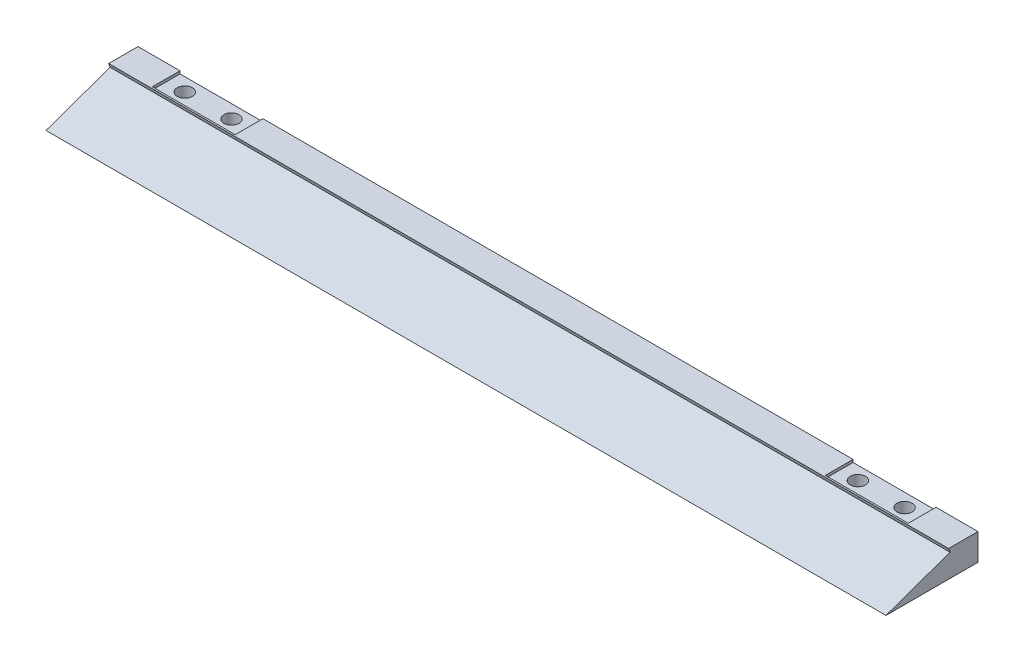
from build123d import *

# Parameters (mm, degrees)
SKETCH1_W            = 200
SKETCH1_H            = 30
BASE_DEPTH           = 6.35
WEDGECUT_REACH       = 202.662
SKETCH3_W            = 19.745999878
SKETCH3_H            = 6.604
HINGE_CUTOUT_DEPTH   = 0.635
HINGE_HOLE_CUT_REACH = 103.28
SKETCH4_R            = 1.8034
SKETCH5_W            = 5.05
SKETCH5_H            = 5.05
HINGE_NUT_CUT_DEPTH  = 2


with BuildPart() as part:
    # Sketch1 → Base (new body)
    with BuildSketch(Plane(origin=(0, 0, 0), x_dir=(1, 0, 0), z_dir=(0, 1, 0))):
        Rectangle(SKETCH1_W, SKETCH1_H)
    extrude(amount=BASE_DEPTH)

    # Sketch2 → WedgeCut (cut, up to next)
    with BuildSketch(Plane(origin=(100, 0, 0), x_dir=(0, 0, -1), z_dir=(1, 0, 0)), mode=Mode.PRIVATE) as wedgecut_sk1:
        Polygon((-15, 0), (-6.907470508, 0), (8.342084542, 5.407501552), (8.007874016, 6.35), (-15, 6.35), align=None)
    wedgecut_tool1 = extrude(wedgecut_sk1.sketch, amount=-WEDGECUT_REACH, mode=Mode.PRIVATE) & part.part
    add(wedgecut_tool1.solids().sort_by_distance((100, 3.70048, 5.888491))[0], mode=Mode.SUBTRACT)

    # Sketch3 → Hinge Cutout (cut)
    with BuildSketch(Plane(origin=(0, 6.35, 0), x_dir=(1, 0, 0), z_dir=(0, 1, 0))):
        with Locations((-80.127000061, 11.698)):
            Rectangle(SKETCH3_W, SKETCH3_H)
        with Locations((80.127000061, 11.698)):
            Rectangle(SKETCH3_W, SKETCH3_H)
    extrude(amount=-HINGE_CUTOUT_DEPTH, mode=Mode.SUBTRACT)

    # Sketch4 → Hinge Hole Cut (cut, up to next)
    with BuildSketch(Plane(origin=(0, 5.715, 0), x_dir=(1, 0, 0), z_dir=(0, 1, 0)), mode=Mode.PRIVATE) as hinge_hole_cut_sk1:
        with Locations((74.564400061, 11.825)):
            Circle(SKETCH4_R)
    hinge_hole_cut_tool1 = extrude(hinge_hole_cut_sk1.sketch, amount=-HINGE_HOLE_CUT_REACH, mode=Mode.PRIVATE) & part.part
    # Sketch4 → Hinge Hole Cut (cut, up to next)
    with BuildSketch(Plane(origin=(0, 5.715, 0), x_dir=(1, 0, 0), z_dir=(0, 1, 0)), mode=Mode.PRIVATE) as hinge_hole_cut_sk2:
        with Locations((85.689600061, 11.825)):
            Circle(SKETCH4_R)
    hinge_hole_cut_tool2 = extrude(hinge_hole_cut_sk2.sketch, amount=-HINGE_HOLE_CUT_REACH, mode=Mode.PRIVATE) & part.part
    hinge_hole_cut_1 = hinge_hole_cut_tool1.solids().sort_by_distance((74.5644, 5.715, -11.825))[0]
    add(hinge_hole_cut_1, mode=Mode.SUBTRACT)
    hinge_hole_cut_2 = hinge_hole_cut_tool2.solids().sort_by_distance((85.6896, 5.715, -11.825))[0]
    add(hinge_hole_cut_2, mode=Mode.SUBTRACT)
    hinge_hole_cut = hinge_hole_cut_1 + hinge_hole_cut_2  # Hinge Hole Cut as one shape, for the pattern or mirror that repeats it

    # Sketch5 → Hinge Nut Cut (cut)
    with BuildSketch(Plane.XZ):
        with Locations((74.564400061, -11.825)):
            Rectangle(SKETCH5_W, SKETCH5_H)
        with Locations((85.689600061, -11.825)):
            Rectangle(SKETCH5_W, SKETCH5_H)
    hinge_nut_cut = extrude(amount=-HINGE_NUT_CUT_DEPTH, mode=Mode.SUBTRACT)

    # Hinge Hole Mirror: Hinge Hole Cut, Hinge Nut Cut across plane
    add(hinge_hole_cut.mirror(Plane(origin=(0, 0, 0), x_dir=(0, 0, 1), z_dir=(1, 0, 0))), mode=Mode.SUBTRACT)
    add(hinge_nut_cut.mirror(Plane(origin=(0, 0, 0), x_dir=(0, 0, 1), z_dir=(1, 0, 0))), mode=Mode.SUBTRACT)


solid = part.part
